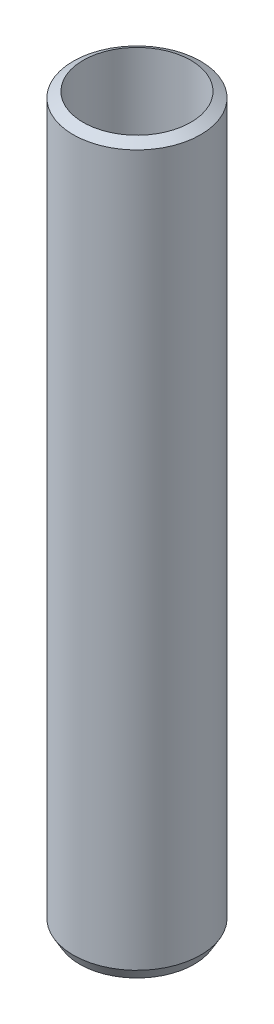
from build123d import *

# Parameters (mm, degrees)
SKETCH1_R           = 52.5
BOSS_EXTRUDE1_DEPTH = 600
SKETCH2_R           = 44.334088823
CUT_EXTRUDE1_DEPTH  = 605.576297914
CHAMFER1_SIZE       = 5.362643
CHAMFER1_SIZE_2     = 9.288371


with BuildPart() as part:
    # Sketch1 → Boss-Extrude1 (new body)
    with BuildSketch(Plane(origin=(0, 0, 0), x_dir=(1, 0, 0), z_dir=(0, 1, 0))):
        with Locations(Location((0, 0, 0), (0, 0, 270))):
            Circle(SKETCH1_R)
    extrude(amount=BOSS_EXTRUDE1_DEPTH)

    # Sketch2 → Cut-Extrude1 (cut, through all)
    with BuildSketch(Plane(origin=(0, 0, 0), x_dir=(1, 0, 0), z_dir=(0, 1, 0))):
        with Locations(Location((0, 0, 0), (0, 0, 270))):
            Circle(SKETCH2_R)
    extrude(amount=CUT_EXTRUDE1_DEPTH, mode=Mode.SUBTRACT)

    # Chamfer1
    # the kernel refuses this chamfer: 9.288371, 5.362643 mm, written as the material it takes off along each edge
    with BuildSketch(Plane(origin=(0, 600, 0), x_dir=(0, 0, 1), z_dir=(-1, 0, 0))) as chamfer1_piece_1:
        Polygon((52.5, -CHAMFER1_SIZE), (52.5 - CHAMFER1_SIZE_2, 0), (52.5, 0), align=None)
    revolve(axis=Axis((0, 600, 0), (0, 1, 0)), mode=Mode.SUBTRACT)
    with BuildSketch(Plane(origin=(0, 0, 0), x_dir=(0, 0, 1), z_dir=(-1, 0, 0))) as chamfer1_piece_2:
        Polygon((52.5, CHAMFER1_SIZE_2), (52.5 - CHAMFER1_SIZE, 0), (52.5, 0), align=None)
    revolve(axis=Axis((0, 0, 0), (0, 1, 0)), mode=Mode.SUBTRACT)


solid = part.part
